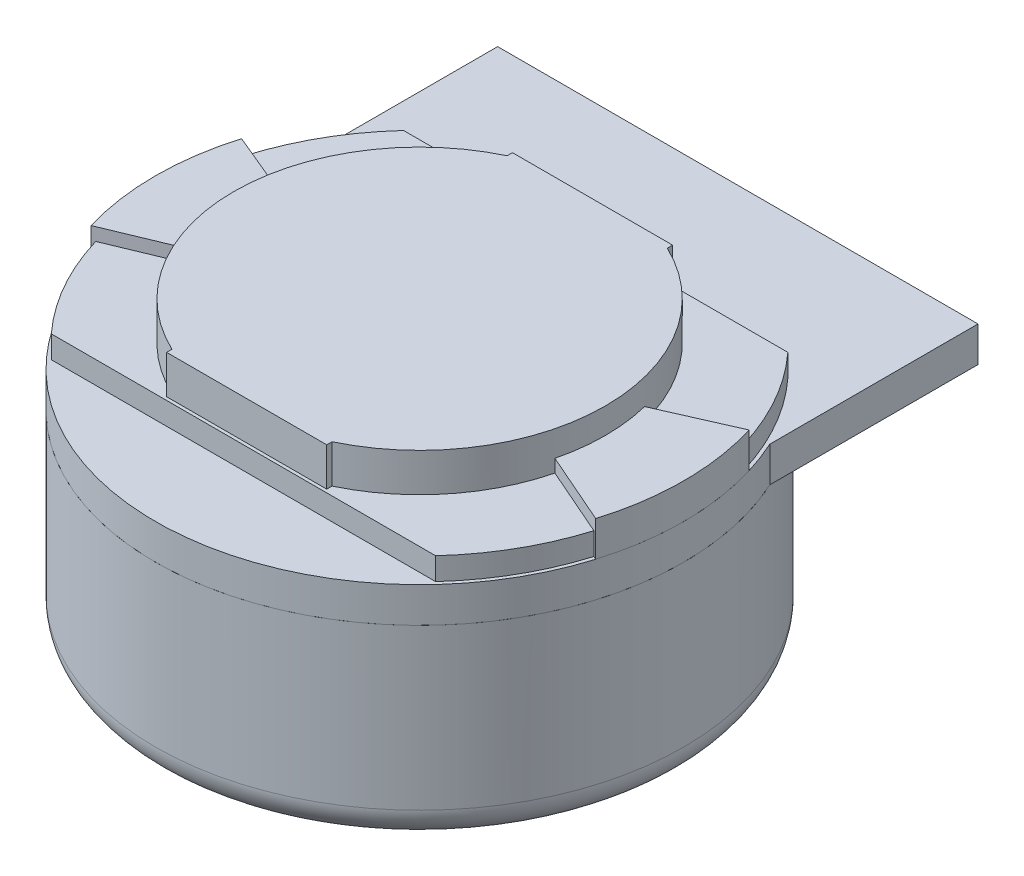
from build123d import *

# Parameters (mm, degrees)
SKETCH1_R             = 8.25
BOSS_EXTRUDE1_DEPTH   = 6
FILLET1_R             = 1
CUT_EXTRUDE1_START    = -2
CUT_EXTRUDE1_DEPTH    = 2
SKETCH3_R             = 8
CUT_EXTRUDE2_DEPTH    = 5.6
BOSS_EXTRUDE2_DEPTH   = 1.1
BOSS_EXTRUDE3_DEPTH   = 0.7
BOSS_EXTRUDE4_DEPTH   = 1.2
CUT_EXTRUDE4_DEPTH    = 0.7
BOSS_EXTRUDE6_DEPTH   = 1.1
BOSS_EXTRUDE6_2_DEPTH = 1.1


with BuildPart() as part:
    # Sketch1 → Boss-Extrude1 (new body)
    with BuildSketch(Plane(origin=(0, 0, 0), x_dir=(1, 0, 0), z_dir=(0, 1, 0))):
        Circle(SKETCH1_R)
    extrude(amount=BOSS_EXTRUDE1_DEPTH)

    # Fillet1
    fillet1_edges = [part.edges().sort_by_distance(p)[0] for p in [
        (-8.25, 0, 0),
    ]]
    fillet(fillet1_edges, radius=FILLET1_R)

    # Sketch2 → Cut-Extrude1 (cut)
    with BuildSketch(Plane(origin=(0, 6, 0), x_dir=(1, 0, 0), z_dir=(0, 1, 0)).offset(CUT_EXTRUDE1_START)):
        with BuildLine():
            Line((-6.000001027, 5.662374738), (6.000001027, 5.662374738))
            ThreePointArc((6.000001027, 5.662374738), (0, 8.25), (-6.000001027, 5.662374738))
        make_face()
    extrude(amount=CUT_EXTRUDE1_DEPTH, mode=Mode.SUBTRACT)

    # Sketch3 → Cut-Extrude2 (cut)
    with BuildSketch(Plane(origin=(0, 6, 0), x_dir=(1, 0, 0), z_dir=(0, 1, 0))):
        Circle(SKETCH3_R)
    extrude(amount=-CUT_EXTRUDE2_DEPTH, mode=Mode.SUBTRACT)


with BuildPart() as body_2:
    # Sketch4 → Boss-Extrude2 (new body)
    with BuildSketch(Plane(origin=(0, 6, 0), x_dir=(1, 0, 0), z_dir=(0, 1, 0))):
        with BuildLine():
            Line((-7.5, 3.436931771), (-7.5, 9.936931771))
            Line((-7.5, 9.936931771), (7.5, 9.936931771))
            Line((7.5, 9.936931771), (7.5, 3.436931771))
            ThreePointArc((7.5, 3.436931771), (0, -8.25), (-7.5, 3.436931771))
        make_face()
    extrude(amount=BOSS_EXTRUDE2_DEPTH)


with BuildPart() as body_3:
    # Sketch6 → Boss-Extrude3 (new body)
    with BuildSketch(Plane(origin=(0, 7.1, 0), x_dir=(1, 0, 0), z_dir=(0, 1, 0))):
        with BuildLine():
            Line((-6, 5.5), (6, 5.5))
            ThreePointArc((6, 5.5), (8.139410298, 0), (6, -5.5))
            Line((6, -5.5), (-6, -5.5))
            ThreePointArc((-6, -5.5), (-8.139410298, 0), (-6, 5.5))
        make_face()
    extrude(amount=BOSS_EXTRUDE3_DEPTH)

    # Sketch7 → Boss-Extrude4 (add)
    with BuildSketch(Plane(origin=(0, 7.8, 0), x_dir=(1, 0, 0), z_dir=(0, 1, 0))):
        with BuildLine():
            Line((2.5, -5.4), (2.5, -5.233545643))
            ThreePointArc((2.5, -5.233545643), (5.8, 0), (2.5, 5.233545643))
            Line((2.5, 5.233545643), (2.5, 5.4))
            Line((2.5, 5.4), (-2.5, 5.4))
            Line((-2.5, 5.4), (-2.5, 5.233545643))
            ThreePointArc((-2.5, 5.233545643), (-5.8, 0), (-2.5, -5.233545643))
            Line((-2.5, -5.233545643), (-2.5, -5.4))
            Line((-2.5, -5.4), (2.5, -5.4))
        make_face()
    extrude(amount=BOSS_EXTRUDE4_DEPTH)

    # Sketch11 → Cut-Extrude4 (cut)
    with BuildSketch(Plane(origin=(0, 7.1, 0), x_dir=(1, 0, 0), z_dir=(0, 1, 0))):
        with BuildLine():
            Line((-7.908223842, 2.349999078), (-5.629366176, 1.396508666))
            ThreePointArc((-5.629366176, 1.396508666), (-5.799998884, -0.003597716), (-5.627629348, -1.403491334))
            Line((-5.627629348, -1.403491334), (-7.908223294, -2.350000922))
            ThreePointArc((-7.908223294, -2.350000922), (-8.25, -9.62e-07), (-7.908223842, 2.349999078))
        make_face()
        with BuildLine():
            Line((7.792785403, 2.349999078), (5.629366176, 1.396508666))
            ThreePointArc((5.629366176, 1.396508666), (5.799999092, -0.003244661), (5.627800171, -1.402806199))
            Line((5.627800171, -1.402806199), (7.792785403, -2.349999078))
            ThreePointArc((7.792785403, -2.349999078), (8.139410298, 0), (7.792785403, 2.349999078))
        make_face()
    extrude(amount=CUT_EXTRUDE4_DEPTH, mode=Mode.SUBTRACT)


with BuildPart() as body_4:
    # Sketch12 → Boss-Extrude6 (new body)
    with BuildSketch(Plane(origin=(0, 7.1, 0), x_dir=(1, 0, 0), z_dir=(0, 1, 0))):
        with BuildLine():
            Line((-5.627629348, -1.403491334), (-7.908158746, -2.350218129))
            ThreePointArc((-7.908158746, -2.350218129), (-8.25, 0), (-7.908158746, 2.350218129))
            Line((-7.908158746, 2.350218129), (-5.629366176, 1.396508666))
            ThreePointArc((-5.629366176, 1.396508666), (-5.799998884, -0.003597716), (-5.627629348, -1.403491334))
        make_face()
    extrude(amount=BOSS_EXTRUDE6_DEPTH)


with BuildPart() as body_5:
    # Sketch12 → Boss-Extrude6 2 (new body)
    with BuildSketch(Plane(origin=(0, 7.1, 0), x_dir=(1, 0, 0), z_dir=(0, 1, 0))):
        with BuildLine():
            Line((5.629366176, 1.396508666), (7.894732862, 2.394930696))
            ThreePointArc((7.894732862, 2.394930696), (8.25, 0), (7.894732862, -2.394930696))
            Line((7.894732862, -2.394930696), (5.627800171, -1.402806199))
            ThreePointArc((5.627800171, -1.402806199), (5.799999092, -0.003244661), (5.629366176, 1.396508666))
        make_face()
    extrude(amount=BOSS_EXTRUDE6_2_DEPTH)


solid = Compound([part.part, body_2.part, body_3.part, body_4.part, body_5.part])
